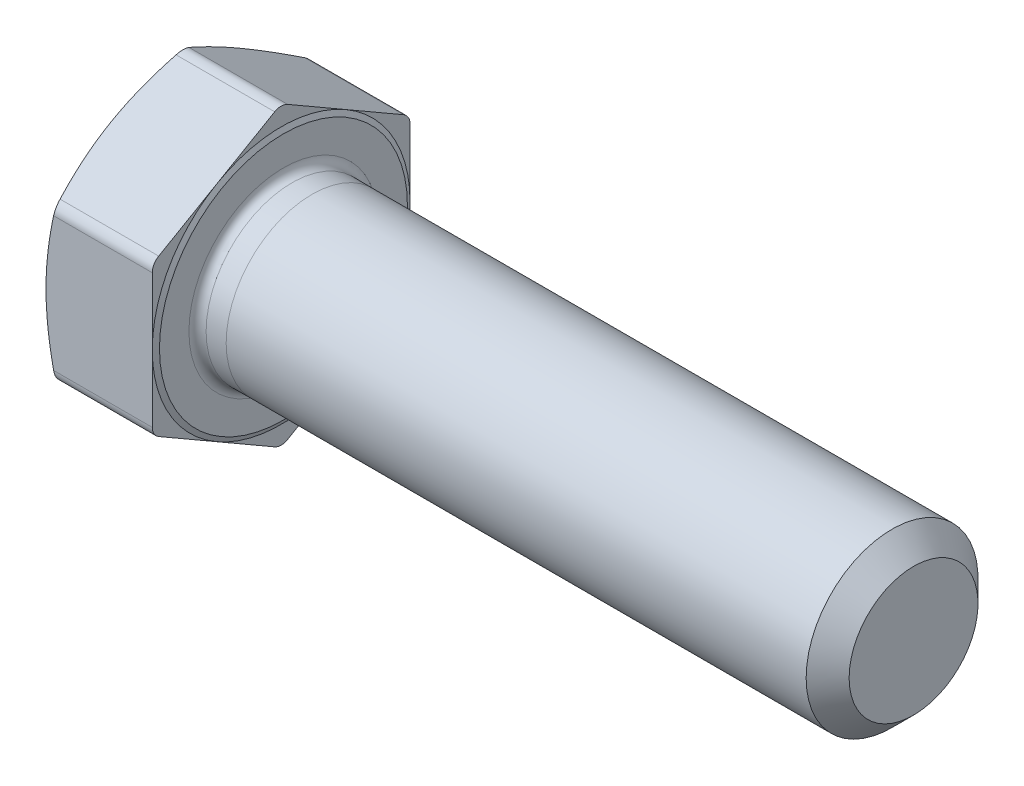
from build123d import *

# Parameters (mm, degrees)
SKETCH2_R                = 4.7625
BOSS_EXTRUDE1_DEPTH      = 34.925
BOSS_EXTRUDE2_DEPTH      = 6.35
SKETCH5_OUTSIDE_W        = 52.862
SKETCH5_OUTSIDE_H        = 55.072
SKETCH5_OUTSIDE_R        = 6.429375
CUT_EXTRUDE1_DEPTH       = 6.35
CUT_EXTRUDE1_DRAFT       = -65
BOSS_EXTRUDE5_DEPTH      = 0.0635
FILLET5_R                = 0.0635
CIRPATTERN1_COUNT        = 6
FILLET5_OF_CIRPATTERN1_R = 0.0635
FILLET7_R                = 0.714375
CHAMFER1_SIZE            = 1.190625
FILLET4_R                = 0.47625


with BuildPart() as part:
    # Sketch2 → Boss-Extrude1 (new body)
    with BuildSketch(Plane(origin=(0, 0, 0), x_dir=(0, 0, -1), z_dir=(1, 0, 0))):
        Circle(SKETCH2_R)
    extrude(amount=BOSS_EXTRUDE1_DEPTH)

    # Sketch3 → Boss-Extrude2 (add)
    with BuildSketch(Plane.ZY):
        Polygon((0, 8.248891971), (-7.14375, 4.124445986), (-7.14375, -4.124445986), (0, -8.248891971), (7.14375, -4.124445986), (7.14375, 4.124445986), align=None)
    extrude(amount=BOSS_EXTRUDE2_DEPTH)


with BuildPart() as cut_extrude1_tool:
    # Sketch5 outside → Cut-Extrude1 (with draft: the straight prism first)
    with BuildSketch(Plane.ZY.offset(6.35)):
        Rectangle(SKETCH5_OUTSIDE_W, SKETCH5_OUTSIDE_H)
        Circle(SKETCH5_OUTSIDE_R, mode=Mode.SUBTRACT)
    extrude(amount=-CUT_EXTRUDE1_DEPTH)
    # Cut-Extrude1: the draft: its side faces are tilted about the plane it starts from
    cut_extrude1_sides = [cut_extrude1_tool.faces().sort_by_distance(p)[0] for p in [
        (-3.175, -27.536, 0),
        (-3.175, 0, 26.431),
        (-3.175, 27.536, 0),
        (-3.175, 0, -26.431),
        (-3.175, 0, -6.429375),
    ]]
    draft(cut_extrude1_sides, Plane.ZY.offset(6.35), CUT_EXTRUDE1_DRAFT)


with BuildPart() as part_1:
    add(part.part)

    # Cut-Extrude1: cut by cut_extrude1_tool
    add(cut_extrude1_tool.part, mode=Mode.SUBTRACT)

    # Sketch11 → Boss-Extrude5 (add)
    with BuildSketch(Plane.ZY.offset(6.35)):
        with BuildLine():
            Line((0.28575, 5.0720625), (0.28575, 3.14325))
            ThreePointArc((0.28575, 3.14325), (0, 2.8575), (-0.28575, 3.14325))
            Line((-0.28575, 3.14325), (-0.28575, 5.0720625))
            ThreePointArc((-0.28575, 5.0720625), (0, 5.3578125), (0.28575, 5.0720625))
        make_face()
    boss_extrude5 = extrude(amount=BOSS_EXTRUDE5_DEPTH)

    # Fillet5
    fillet5_edges = [part_1.edges().sort_by_distance(p)[0] for p in [
        (-6.4135, 4.10765625, 0.28575),
        (-6.4135, 2.8575, 0),
        (-6.4135, 4.10765625, -0.28575),
        (-6.4135, 5.3578125, 0),
    ]]
    fillet(fillet5_edges, radius=FILLET5_R - 0.0001)  # a hair under: the kernel refuses the full size

    # CirPattern1: Boss-Extrude5 ×6 about axis
    cirpattern1_axis = Axis((0, 0, 0), (1, 0, 0))
    for i in range(1, CIRPATTERN1_COUNT):
        add(boss_extrude5.rotate(cirpattern1_axis, i * 360 / CIRPATTERN1_COUNT))

    # Fillet5 of CirPattern1
    fillet5_of_cirpattern1_edges = [part_1.edges().sort_by_distance(p)[0] for p in [
        (-6.4135, 1.806361366, 3.700209663),
        (-6.4135, 1.42875, 2.474667591),
        (-6.4135, 2.301294884, 3.414459663),
        (-6.4135, 2.67890625, 4.640001734),
        (-6.4135, -2.301294884, 3.414459663),
        (-6.4135, -1.42875, 2.474667591),
        (-6.4135, -1.806361366, 3.700209663),
        (-6.4135, -2.67890625, 4.640001734),
        (-6.4135, -4.10765625, -0.28575),
        (-6.4135, -2.8575, 0),
        (-6.4135, -4.10765625, 0.28575),
        (-6.4135, -5.3578125, 0),
        (-6.4135, -1.806361366, -3.700209663),
        (-6.4135, -1.42875, -2.474667591),
        (-6.4135, -2.301294884, -3.414459663),
        (-6.4135, -2.67890625, -4.640001734),
        (-6.4135, 2.301294884, -3.414459663),
        (-6.4135, 1.42875, -2.474667591),
        (-6.4135, 1.806361366, -3.700209663),
        (-6.4135, 2.67890625, -4.640001734),
    ]]
    fillet(fillet5_of_cirpattern1_edges, radius=FILLET5_OF_CIRPATTERN1_R - 0.0001)  # a hair under: the kernel refuses the full size

    # Fillet7
    fillet7_edges = [part_1.edges().sort_by_distance(p)[0] for p in [
        (-2.750772651, -8.248891971, 0),
        (-2.750772651, -4.124445986, -7.14375),
        (-2.750772651, 4.124445986, -7.14375),
        (-2.750772651, 8.248891971, 0),
        (-2.750772651, -4.124445986, 7.14375),
        (-2.750772651, 4.124445986, 7.14375),
    ]]
    fillet(fillet7_edges, radius=FILLET7_R)

    # Chamfer1
    chamfer1_edges = [part_1.edges().sort_by_distance(p)[0] for p in [
        (34.925, 0, 4.7625),
    ]]
    chamfer(chamfer1_edges, length=CHAMFER1_SIZE)

    # Sketch15 → Cut-Revolve1 (revolve, cut)
    with BuildSketch(Plane.XY, mode=Mode.PRIVATE) as cut_revolve1_sk:
        Polygon((0, 6.871397621), (-0.127, 7.14375), (-0.127, 8.248891971), (0, 8.248891971), align=None)
    revolve(cut_revolve1_sk.sketch.rotate(Axis((0, 0, 0), (-1, 0, 0)), 270), axis=Axis((0, 0, 0), (-1, 0, 0)), mode=Mode.SUBTRACT)

    # Fillet4
    fillet4_edges = [part_1.edges().sort_by_distance(p)[0] for p in [
        (0, 0, 4.7625),
    ]]
    fillet(fillet4_edges, radius=FILLET4_R)


with BuildPart() as body_2:
    # Split1: the piece on the far side of the plane
    add(part_1.part)
    split(bisect_by=Plane(origin=(1.5875, 0, 0), x_dir=(0, 0, 1), z_dir=(1, 0, 0)), keep=Keep.BOTTOM)


with BuildPart() as part_2:
    add(part_1.part)

    # Split1
    split(bisect_by=Plane(origin=(1.5875, 0, 0), x_dir=(0, 0, 1), z_dir=(1, 0, 0)), keep=Keep.TOP)


solid = Compound([body_2.part, part_2.part])
